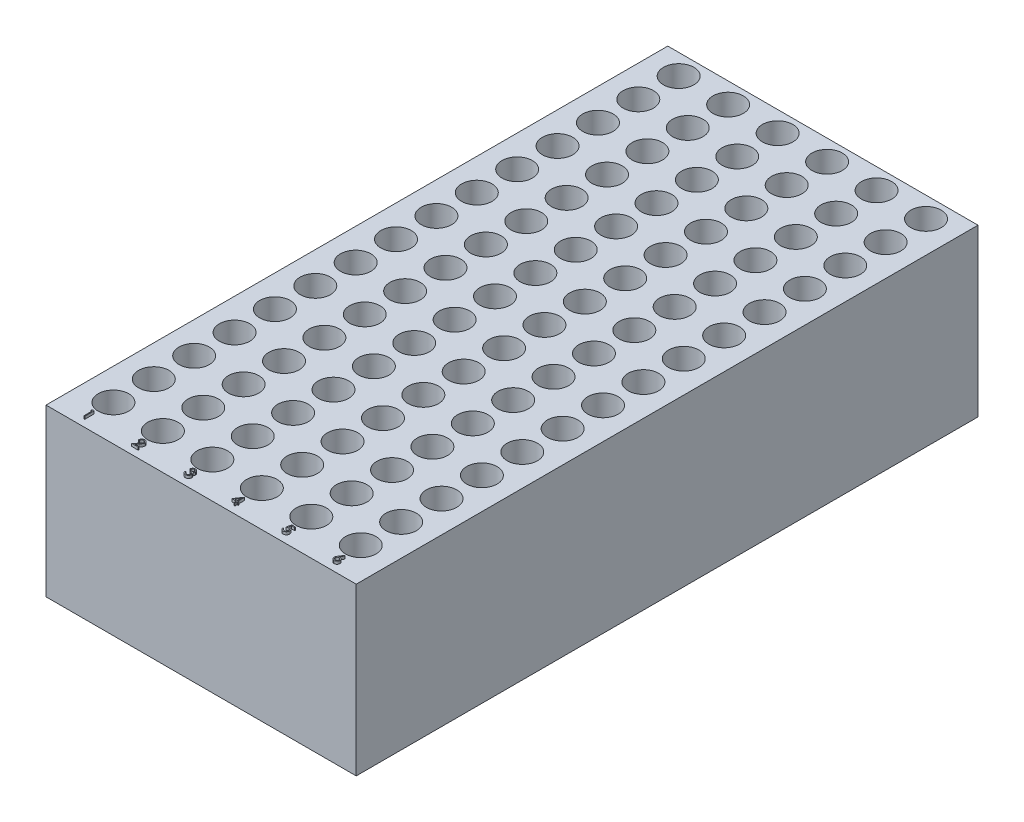
from build123d import *

# Parameters (mm, degrees)
SKETCH1_W           = 115.25
SKETCH1_H           = 231
SKETCH1_R           = 5.65
BOSS_EXTRUDE1_DEPTH = 51.7
SKETCH2_W           = 115.25
SKETCH2_H           = 231
BOSS_EXTRUDE2_DEPTH = 10
SKETCH3_R           = 5.65
SKETCH3_R_2         = 4.225
BOSS_EXTRUDE4_DEPTH = 30
BOSS_EXTRUDE5_DEPTH = 1


with BuildPart() as part:
    # Sketch1 → Boss-Extrude1 (new body)
    with BuildSketch(Plane(origin=(0, 0, 0), x_dir=(1, 0, 0), z_dir=(0, 1, 0))):
        Rectangle(SKETCH1_W, SKETCH1_H)
        with Locations((-45.946843854, 107.87)):
            Circle(SKETCH1_R, mode=Mode.SUBTRACT)
        with Locations((-27.568106312, 107.87)):
            Circle(SKETCH1_R, mode=Mode.SUBTRACT)
        with Locations((-9.189368771, 107.87)):
            Circle(SKETCH1_R, mode=Mode.SUBTRACT)
        with Locations((9.189368771, 107.87)):
            Circle(SKETCH1_R, mode=Mode.SUBTRACT)
        with Locations((27.568106312, 107.87)):
            Circle(SKETCH1_R, mode=Mode.SUBTRACT)
        with Locations((45.946843854, 107.87)):
            Circle(SKETCH1_R, mode=Mode.SUBTRACT)
        with Locations((-45.946843854, 92.87)):
            Circle(SKETCH1_R, mode=Mode.SUBTRACT)
        with Locations((-27.568106312, 92.87)):
            Circle(SKETCH1_R, mode=Mode.SUBTRACT)
        with Locations((-9.189368771, 92.87)):
            Circle(SKETCH1_R, mode=Mode.SUBTRACT)
        with Locations((9.189368771, 92.87)):
            Circle(SKETCH1_R, mode=Mode.SUBTRACT)
        with Locations((27.568106312, 92.87)):
            Circle(SKETCH1_R, mode=Mode.SUBTRACT)
        with Locations((45.946843854, 92.87)):
            Circle(SKETCH1_R, mode=Mode.SUBTRACT)
        with Locations((-45.946843854, 77.87)):
            Circle(SKETCH1_R, mode=Mode.SUBTRACT)
        with Locations((-27.568106312, 77.87)):
            Circle(SKETCH1_R, mode=Mode.SUBTRACT)
        with Locations((-9.189368771, 77.87)):
            Circle(SKETCH1_R, mode=Mode.SUBTRACT)
        with Locations((9.189368771, 77.87)):
            Circle(SKETCH1_R, mode=Mode.SUBTRACT)
        with Locations((27.568106312, 77.87)):
            Circle(SKETCH1_R, mode=Mode.SUBTRACT)
        with Locations((45.946843854, 77.87)):
            Circle(SKETCH1_R, mode=Mode.SUBTRACT)
        with Locations((-45.946843854, 62.87)):
            Circle(SKETCH1_R, mode=Mode.SUBTRACT)
        with Locations((-27.568106312, 62.87)):
            Circle(SKETCH1_R, mode=Mode.SUBTRACT)
        with Locations((-9.189368771, 62.87)):
            Circle(SKETCH1_R, mode=Mode.SUBTRACT)
        with Locations((9.189368771, 62.87)):
            Circle(SKETCH1_R, mode=Mode.SUBTRACT)
        with Locations((27.568106312, 62.87)):
            Circle(SKETCH1_R, mode=Mode.SUBTRACT)
        with Locations((45.946843854, 62.87)):
            Circle(SKETCH1_R, mode=Mode.SUBTRACT)
        with Locations((-45.946843854, 47.87)):
            Circle(SKETCH1_R, mode=Mode.SUBTRACT)
        with Locations((-27.568106312, 47.87)):
            Circle(SKETCH1_R, mode=Mode.SUBTRACT)
        with Locations((-9.189368771, 47.87)):
            Circle(SKETCH1_R, mode=Mode.SUBTRACT)
        with Locations((9.189368771, 47.87)):
            Circle(SKETCH1_R, mode=Mode.SUBTRACT)
        with Locations((27.568106312, 47.87)):
            Circle(SKETCH1_R, mode=Mode.SUBTRACT)
        with Locations((45.946843854, 47.87)):
            Circle(SKETCH1_R, mode=Mode.SUBTRACT)
        with Locations((-45.946843854, 32.87)):
            Circle(SKETCH1_R, mode=Mode.SUBTRACT)
        with Locations((-27.568106312, 32.87)):
            Circle(SKETCH1_R, mode=Mode.SUBTRACT)
        with Locations((-9.189368771, 32.87)):
            Circle(SKETCH1_R, mode=Mode.SUBTRACT)
        with Locations((9.189368771, 32.87)):
            Circle(SKETCH1_R, mode=Mode.SUBTRACT)
        with Locations((27.568106312, 32.87)):
            Circle(SKETCH1_R, mode=Mode.SUBTRACT)
        with Locations((45.946843854, 32.87)):
            Circle(SKETCH1_R, mode=Mode.SUBTRACT)
        with Locations((-45.946843854, 17.87)):
            Circle(SKETCH1_R, mode=Mode.SUBTRACT)
        with Locations((-27.568106312, 17.87)):
            Circle(SKETCH1_R, mode=Mode.SUBTRACT)
        with Locations((-9.189368771, 17.87)):
            Circle(SKETCH1_R, mode=Mode.SUBTRACT)
        with Locations((9.189368771, 17.87)):
            Circle(SKETCH1_R, mode=Mode.SUBTRACT)
        with Locations((27.568106312, 17.87)):
            Circle(SKETCH1_R, mode=Mode.SUBTRACT)
        with Locations((45.946843854, 17.87)):
            Circle(SKETCH1_R, mode=Mode.SUBTRACT)
        with Locations((-45.946843854, 2.87)):
            Circle(SKETCH1_R, mode=Mode.SUBTRACT)
        with Locations((-27.568106312, 2.87)):
            Circle(SKETCH1_R, mode=Mode.SUBTRACT)
        with Locations((-9.189368771, 2.87)):
            Circle(SKETCH1_R, mode=Mode.SUBTRACT)
        with Locations((9.189368771, 2.87)):
            Circle(SKETCH1_R, mode=Mode.SUBTRACT)
        with Locations((27.568106312, 2.87)):
            Circle(SKETCH1_R, mode=Mode.SUBTRACT)
        with Locations((45.946843854, 2.87)):
            Circle(SKETCH1_R, mode=Mode.SUBTRACT)
        with Locations((-45.946843854, -12.13)):
            Circle(SKETCH1_R, mode=Mode.SUBTRACT)
        with Locations((-27.568106312, -12.13)):
            Circle(SKETCH1_R, mode=Mode.SUBTRACT)
        with Locations((-9.189368771, -12.13)):
            Circle(SKETCH1_R, mode=Mode.SUBTRACT)
        with Locations((9.189368771, -12.13)):
            Circle(SKETCH1_R, mode=Mode.SUBTRACT)
        with Locations((27.568106312, -12.13)):
            Circle(SKETCH1_R, mode=Mode.SUBTRACT)
        with Locations((45.946843854, -12.13)):
            Circle(SKETCH1_R, mode=Mode.SUBTRACT)
        with Locations((-45.946843854, -27.13)):
            Circle(SKETCH1_R, mode=Mode.SUBTRACT)
        with Locations((-27.568106312, -27.13)):
            Circle(SKETCH1_R, mode=Mode.SUBTRACT)
        with Locations((-9.189368771, -27.13)):
            Circle(SKETCH1_R, mode=Mode.SUBTRACT)
        with Locations((9.189368771, -27.13)):
            Circle(SKETCH1_R, mode=Mode.SUBTRACT)
        with Locations((27.568106312, -27.13)):
            Circle(SKETCH1_R, mode=Mode.SUBTRACT)
        with Locations((45.946843854, -27.13)):
            Circle(SKETCH1_R, mode=Mode.SUBTRACT)
        with Locations((-45.946843854, -42.13)):
            Circle(SKETCH1_R, mode=Mode.SUBTRACT)
        with Locations((-27.568106312, -42.13)):
            Circle(SKETCH1_R, mode=Mode.SUBTRACT)
        with Locations((-9.189368771, -42.13)):
            Circle(SKETCH1_R, mode=Mode.SUBTRACT)
        with Locations((9.189368771, -42.13)):
            Circle(SKETCH1_R, mode=Mode.SUBTRACT)
        with Locations((27.568106312, -42.13)):
            Circle(SKETCH1_R, mode=Mode.SUBTRACT)
        with Locations((45.946843854, -42.13)):
            Circle(SKETCH1_R, mode=Mode.SUBTRACT)
        with Locations((-45.946843854, -57.13)):
            Circle(SKETCH1_R, mode=Mode.SUBTRACT)
        with Locations((-27.568106312, -57.13)):
            Circle(SKETCH1_R, mode=Mode.SUBTRACT)
        with Locations((-9.189368771, -57.13)):
            Circle(SKETCH1_R, mode=Mode.SUBTRACT)
        with Locations((9.189368771, -57.13)):
            Circle(SKETCH1_R, mode=Mode.SUBTRACT)
        with Locations((27.568106312, -57.13)):
            Circle(SKETCH1_R, mode=Mode.SUBTRACT)
        with Locations((45.946843854, -57.13)):
            Circle(SKETCH1_R, mode=Mode.SUBTRACT)
        with Locations((-45.946843854, -72.13)):
            Circle(SKETCH1_R, mode=Mode.SUBTRACT)
        with Locations((-27.568106312, -72.13)):
            Circle(SKETCH1_R, mode=Mode.SUBTRACT)
        with Locations((-9.189368771, -72.13)):
            Circle(SKETCH1_R, mode=Mode.SUBTRACT)
        with Locations((9.189368771, -72.13)):
            Circle(SKETCH1_R, mode=Mode.SUBTRACT)
        with Locations((27.568106312, -72.13)):
            Circle(SKETCH1_R, mode=Mode.SUBTRACT)
        with Locations((45.946843854, -72.13)):
            Circle(SKETCH1_R, mode=Mode.SUBTRACT)
        with Locations((-45.946843854, -87.13)):
            Circle(SKETCH1_R, mode=Mode.SUBTRACT)
        with Locations((-27.568106312, -87.13)):
            Circle(SKETCH1_R, mode=Mode.SUBTRACT)
        with Locations((-9.189368771, -87.13)):
            Circle(SKETCH1_R, mode=Mode.SUBTRACT)
        with Locations((9.189368771, -87.13)):
            Circle(SKETCH1_R, mode=Mode.SUBTRACT)
        with Locations((27.568106312, -87.13)):
            Circle(SKETCH1_R, mode=Mode.SUBTRACT)
        with Locations((45.946843854, -87.13)):
            Circle(SKETCH1_R, mode=Mode.SUBTRACT)
        with Locations((-45.946843854, -102.13)):
            Circle(SKETCH1_R, mode=Mode.SUBTRACT)
        with Locations((-27.568106312, -102.13)):
            Circle(SKETCH1_R, mode=Mode.SUBTRACT)
        with Locations((-9.189368771, -102.13)):
            Circle(SKETCH1_R, mode=Mode.SUBTRACT)
        with Locations((9.189368771, -102.13)):
            Circle(SKETCH1_R, mode=Mode.SUBTRACT)
        with Locations((27.568106312, -102.13)):
            Circle(SKETCH1_R, mode=Mode.SUBTRACT)
        with Locations((45.946843854, -102.13)):
            Circle(SKETCH1_R, mode=Mode.SUBTRACT)
    extrude(amount=BOSS_EXTRUDE1_DEPTH)

    # Sketch2 → Boss-Extrude2 (add)
    with BuildSketch(Plane.XZ):
        Rectangle(SKETCH2_W, SKETCH2_H)
    extrude(amount=BOSS_EXTRUDE2_DEPTH)

    # Sketch3 → Boss-Extrude4 (add)
    # profile 1 of 90: a face of its own
    with BuildSketch(Plane(origin=(0, 0, 0), x_dir=(1, 0, 0), z_dir=(0, 1, 0))):
        with Locations((-45.946843854, -102.13)):
            Circle(SKETCH3_R)
        with Locations((-45.946843854, -102.13)):
            Circle(SKETCH3_R_2, mode=Mode.SUBTRACT)
    # profile 2 of 90: a face of its own
    with BuildSketch(Plane(origin=(0, 0, 0), x_dir=(1, 0, 0), z_dir=(0, 1, 0))):
        with Locations((-27.566843854, -102.13)):
            Circle(SKETCH3_R)
        with Locations((-27.566843854, -102.13)):
            Circle(SKETCH3_R_2, mode=Mode.SUBTRACT)
    # profile 3 of 90: a face of its own
    with BuildSketch(Plane(origin=(0, 0, 0), x_dir=(1, 0, 0), z_dir=(0, 1, 0))):
        with Locations((-9.186843854, -102.13)):
            Circle(SKETCH3_R)
        with Locations((-9.186843854, -102.13)):
            Circle(SKETCH3_R_2, mode=Mode.SUBTRACT)
    # profile 4 of 90: a face of its own
    with BuildSketch(Plane(origin=(0, 0, 0), x_dir=(1, 0, 0), z_dir=(0, 1, 0))):
        with Locations((9.193156146, -102.13)):
            Circle(SKETCH3_R)
        with Locations((9.193156146, -102.13)):
            Circle(SKETCH3_R_2, mode=Mode.SUBTRACT)
    # profile 5 of 90: a face of its own
    with BuildSketch(Plane(origin=(0, 0, 0), x_dir=(1, 0, 0), z_dir=(0, 1, 0))):
        with Locations((27.573156146, -102.13)):
            Circle(SKETCH3_R)
        with Locations((27.573156146, -102.13)):
            Circle(SKETCH3_R_2, mode=Mode.SUBTRACT)
    # profile 6 of 90: a face of its own
    with BuildSketch(Plane(origin=(0, 0, 0), x_dir=(1, 0, 0), z_dir=(0, 1, 0))):
        with Locations((45.953156146, -102.13)):
            Circle(SKETCH3_R)
        with Locations((45.953156146, -102.13)):
            Circle(SKETCH3_R_2, mode=Mode.SUBTRACT)
    # profile 7 of 90: a face of its own
    with BuildSketch(Plane(origin=(0, 0, 0), x_dir=(1, 0, 0), z_dir=(0, 1, 0))):
        with Locations((-27.566843854, -87.13)):
            Circle(SKETCH3_R)
        with Locations((-27.566843854, -87.13)):
            Circle(SKETCH3_R_2, mode=Mode.SUBTRACT)
    # profile 8 of 90: a face of its own
    with BuildSketch(Plane(origin=(0, 0, 0), x_dir=(1, 0, 0), z_dir=(0, 1, 0))):
        with Locations((-9.186843854, -87.13)):
            Circle(SKETCH3_R)
        with Locations((-9.186843854, -87.13)):
            Circle(SKETCH3_R_2, mode=Mode.SUBTRACT)
    # profile 9 of 90: a face of its own
    with BuildSketch(Plane(origin=(0, 0, 0), x_dir=(1, 0, 0), z_dir=(0, 1, 0))):
        with Locations((9.193156146, -87.13)):
            Circle(SKETCH3_R)
        with Locations((9.193156146, -87.13)):
            Circle(SKETCH3_R_2, mode=Mode.SUBTRACT)
    # profile 10 of 90: a face of its own
    with BuildSketch(Plane(origin=(0, 0, 0), x_dir=(1, 0, 0), z_dir=(0, 1, 0))):
        with Locations((27.573156146, -87.13)):
            Circle(SKETCH3_R)
        with Locations((27.573156146, -87.13)):
            Circle(SKETCH3_R_2, mode=Mode.SUBTRACT)
    # profile 11 of 90: a face of its own
    with BuildSketch(Plane(origin=(0, 0, 0), x_dir=(1, 0, 0), z_dir=(0, 1, 0))):
        with Locations((45.953156146, -87.13)):
            Circle(SKETCH3_R)
        with Locations((45.953156146, -87.13)):
            Circle(SKETCH3_R_2, mode=Mode.SUBTRACT)
    # profile 12 of 90: a face of its own
    with BuildSketch(Plane(origin=(0, 0, 0), x_dir=(1, 0, 0), z_dir=(0, 1, 0))):
        with Locations((-27.566843854, -72.13)):
            Circle(SKETCH3_R)
        with Locations((-27.566843854, -72.13)):
            Circle(SKETCH3_R_2, mode=Mode.SUBTRACT)
    # profile 13 of 90: a face of its own
    with BuildSketch(Plane(origin=(0, 0, 0), x_dir=(1, 0, 0), z_dir=(0, 1, 0))):
        with Locations((-9.186843854, -72.13)):
            Circle(SKETCH3_R)
        with Locations((-9.186843854, -72.13)):
            Circle(SKETCH3_R_2, mode=Mode.SUBTRACT)
    # profile 14 of 90: a face of its own
    with BuildSketch(Plane(origin=(0, 0, 0), x_dir=(1, 0, 0), z_dir=(0, 1, 0))):
        with Locations((9.193156146, -72.13)):
            Circle(SKETCH3_R)
        with Locations((9.193156146, -72.13)):
            Circle(SKETCH3_R_2, mode=Mode.SUBTRACT)
    # profile 15 of 90: a face of its own
    with BuildSketch(Plane(origin=(0, 0, 0), x_dir=(1, 0, 0), z_dir=(0, 1, 0))):
        with Locations((27.573156146, -72.13)):
            Circle(SKETCH3_R)
        with Locations((27.573156146, -72.13)):
            Circle(SKETCH3_R_2, mode=Mode.SUBTRACT)
    # profile 16 of 90: a face of its own
    with BuildSketch(Plane(origin=(0, 0, 0), x_dir=(1, 0, 0), z_dir=(0, 1, 0))):
        with Locations((45.953156146, -72.13)):
            Circle(SKETCH3_R)
        with Locations((45.953156146, -72.13)):
            Circle(SKETCH3_R_2, mode=Mode.SUBTRACT)
    # profile 17 of 90: a face of its own
    with BuildSketch(Plane(origin=(0, 0, 0), x_dir=(1, 0, 0), z_dir=(0, 1, 0))):
        with Locations((-27.566843854, -57.13)):
            Circle(SKETCH3_R)
        with Locations((-27.566843854, -57.13)):
            Circle(SKETCH3_R_2, mode=Mode.SUBTRACT)
    # profile 18 of 90: a face of its own
    with BuildSketch(Plane(origin=(0, 0, 0), x_dir=(1, 0, 0), z_dir=(0, 1, 0))):
        with Locations((-9.186843854, -57.13)):
            Circle(SKETCH3_R)
        with Locations((-9.186843854, -57.13)):
            Circle(SKETCH3_R_2, mode=Mode.SUBTRACT)
    # profile 19 of 90: a face of its own
    with BuildSketch(Plane(origin=(0, 0, 0), x_dir=(1, 0, 0), z_dir=(0, 1, 0))):
        with Locations((9.193156146, -57.13)):
            Circle(SKETCH3_R)
        with Locations((9.193156146, -57.13)):
            Circle(SKETCH3_R_2, mode=Mode.SUBTRACT)
    # profile 20 of 90: a face of its own
    with BuildSketch(Plane(origin=(0, 0, 0), x_dir=(1, 0, 0), z_dir=(0, 1, 0))):
        with Locations((27.573156146, -57.13)):
            Circle(SKETCH3_R)
        with Locations((27.573156146, -57.13)):
            Circle(SKETCH3_R_2, mode=Mode.SUBTRACT)
    # profile 21 of 90: a face of its own
    with BuildSketch(Plane(origin=(0, 0, 0), x_dir=(1, 0, 0), z_dir=(0, 1, 0))):
        with Locations((45.953156146, -57.13)):
            Circle(SKETCH3_R)
        with Locations((45.953156146, -57.13)):
            Circle(SKETCH3_R_2, mode=Mode.SUBTRACT)
    # profile 22 of 90: a face of its own
    with BuildSketch(Plane(origin=(0, 0, 0), x_dir=(1, 0, 0), z_dir=(0, 1, 0))):
        with Locations((-27.566843854, -42.13)):
            Circle(SKETCH3_R)
        with Locations((-27.566843854, -42.13)):
            Circle(SKETCH3_R_2, mode=Mode.SUBTRACT)
    # profile 23 of 90: a face of its own
    with BuildSketch(Plane(origin=(0, 0, 0), x_dir=(1, 0, 0), z_dir=(0, 1, 0))):
        with Locations((-9.186843854, -42.13)):
            Circle(SKETCH3_R)
        with Locations((-9.186843854, -42.13)):
            Circle(SKETCH3_R_2, mode=Mode.SUBTRACT)
    # profile 24 of 90: a face of its own
    with BuildSketch(Plane(origin=(0, 0, 0), x_dir=(1, 0, 0), z_dir=(0, 1, 0))):
        with Locations((9.193156146, -42.13)):
            Circle(SKETCH3_R)
        with Locations((9.193156146, -42.13)):
            Circle(SKETCH3_R_2, mode=Mode.SUBTRACT)
    # profile 25 of 90: a face of its own
    with BuildSketch(Plane(origin=(0, 0, 0), x_dir=(1, 0, 0), z_dir=(0, 1, 0))):
        with Locations((27.573156146, -42.13)):
            Circle(SKETCH3_R)
        with Locations((27.573156146, -42.13)):
            Circle(SKETCH3_R_2, mode=Mode.SUBTRACT)
    # profile 26 of 90: a face of its own
    with BuildSketch(Plane(origin=(0, 0, 0), x_dir=(1, 0, 0), z_dir=(0, 1, 0))):
        with Locations((45.953156146, -42.13)):
            Circle(SKETCH3_R)
        with Locations((45.953156146, -42.13)):
            Circle(SKETCH3_R_2, mode=Mode.SUBTRACT)
    # profile 27 of 90: a face of its own
    with BuildSketch(Plane(origin=(0, 0, 0), x_dir=(1, 0, 0), z_dir=(0, 1, 0))):
        with Locations((-27.566843854, -27.13)):
            Circle(SKETCH3_R)
        with Locations((-27.566843854, -27.13)):
            Circle(SKETCH3_R_2, mode=Mode.SUBTRACT)
    # profile 28 of 90: a face of its own
    with BuildSketch(Plane(origin=(0, 0, 0), x_dir=(1, 0, 0), z_dir=(0, 1, 0))):
        with Locations((-9.186843854, -27.13)):
            Circle(SKETCH3_R)
        with Locations((-9.186843854, -27.13)):
            Circle(SKETCH3_R_2, mode=Mode.SUBTRACT)
    # profile 29 of 90: a face of its own
    with BuildSketch(Plane(origin=(0, 0, 0), x_dir=(1, 0, 0), z_dir=(0, 1, 0))):
        with Locations((9.193156146, -27.13)):
            Circle(SKETCH3_R)
        with Locations((9.193156146, -27.13)):
            Circle(SKETCH3_R_2, mode=Mode.SUBTRACT)
    # profile 30 of 90: a face of its own
    with BuildSketch(Plane(origin=(0, 0, 0), x_dir=(1, 0, 0), z_dir=(0, 1, 0))):
        with Locations((27.573156146, -27.13)):
            Circle(SKETCH3_R)
        with Locations((27.573156146, -27.13)):
            Circle(SKETCH3_R_2, mode=Mode.SUBTRACT)
    # profile 31 of 90: a face of its own
    with BuildSketch(Plane(origin=(0, 0, 0), x_dir=(1, 0, 0), z_dir=(0, 1, 0))):
        with Locations((45.953156146, -27.13)):
            Circle(SKETCH3_R)
        with Locations((45.953156146, -27.13)):
            Circle(SKETCH3_R_2, mode=Mode.SUBTRACT)
    # profile 32 of 90: a face of its own
    with BuildSketch(Plane(origin=(0, 0, 0), x_dir=(1, 0, 0), z_dir=(0, 1, 0))):
        with Locations((-27.566843854, -12.13)):
            Circle(SKETCH3_R)
        with Locations((-27.566843854, -12.13)):
            Circle(SKETCH3_R_2, mode=Mode.SUBTRACT)
    # profile 33 of 90: a face of its own
    with BuildSketch(Plane(origin=(0, 0, 0), x_dir=(1, 0, 0), z_dir=(0, 1, 0))):
        with Locations((-9.186843854, -12.13)):
            Circle(SKETCH3_R)
        with Locations((-9.186843854, -12.13)):
            Circle(SKETCH3_R_2, mode=Mode.SUBTRACT)
    # profile 34 of 90: a face of its own
    with BuildSketch(Plane(origin=(0, 0, 0), x_dir=(1, 0, 0), z_dir=(0, 1, 0))):
        with Locations((9.193156146, -12.13)):
            Circle(SKETCH3_R)
        with Locations((9.193156146, -12.13)):
            Circle(SKETCH3_R_2, mode=Mode.SUBTRACT)
    # profile 35 of 90: a face of its own
    with BuildSketch(Plane(origin=(0, 0, 0), x_dir=(1, 0, 0), z_dir=(0, 1, 0))):
        with Locations((27.573156146, -12.13)):
            Circle(SKETCH3_R)
        with Locations((27.573156146, -12.13)):
            Circle(SKETCH3_R_2, mode=Mode.SUBTRACT)
    # profile 36 of 90: a face of its own
    with BuildSketch(Plane(origin=(0, 0, 0), x_dir=(1, 0, 0), z_dir=(0, 1, 0))):
        with Locations((45.953156146, -12.13)):
            Circle(SKETCH3_R)
        with Locations((45.953156146, -12.13)):
            Circle(SKETCH3_R_2, mode=Mode.SUBTRACT)
    # profile 37 of 90: a face of its own
    with BuildSketch(Plane(origin=(0, 0, 0), x_dir=(1, 0, 0), z_dir=(0, 1, 0))):
        with Locations((-27.566843854, 2.87)):
            Circle(SKETCH3_R)
        with Locations((-27.566843854, 2.87)):
            Circle(SKETCH3_R_2, mode=Mode.SUBTRACT)
    # profile 38 of 90: a face of its own
    with BuildSketch(Plane(origin=(0, 0, 0), x_dir=(1, 0, 0), z_dir=(0, 1, 0))):
        with Locations((-9.186843854, 2.87)):
            Circle(SKETCH3_R)
        with Locations((-9.186843854, 2.87)):
            Circle(SKETCH3_R_2, mode=Mode.SUBTRACT)
    # profile 39 of 90: a face of its own
    with BuildSketch(Plane(origin=(0, 0, 0), x_dir=(1, 0, 0), z_dir=(0, 1, 0))):
        with Locations((9.193156146, 2.87)):
            Circle(SKETCH3_R)
        with Locations((9.193156146, 2.87)):
            Circle(SKETCH3_R_2, mode=Mode.SUBTRACT)
    # profile 40 of 90: a face of its own
    with BuildSketch(Plane(origin=(0, 0, 0), x_dir=(1, 0, 0), z_dir=(0, 1, 0))):
        with Locations((27.573156146, 2.87)):
            Circle(SKETCH3_R)
        with Locations((27.573156146, 2.87)):
            Circle(SKETCH3_R_2, mode=Mode.SUBTRACT)
    # profile 41 of 90: a face of its own
    with BuildSketch(Plane(origin=(0, 0, 0), x_dir=(1, 0, 0), z_dir=(0, 1, 0))):
        with Locations((45.953156146, 2.87)):
            Circle(SKETCH3_R)
        with Locations((45.953156146, 2.87)):
            Circle(SKETCH3_R_2, mode=Mode.SUBTRACT)
    # profile 42 of 90: a face of its own
    with BuildSketch(Plane(origin=(0, 0, 0), x_dir=(1, 0, 0), z_dir=(0, 1, 0))):
        with Locations((-27.566843854, 17.87)):
            Circle(SKETCH3_R)
        with Locations((-27.566843854, 17.87)):
            Circle(SKETCH3_R_2, mode=Mode.SUBTRACT)
    # profile 43 of 90: a face of its own
    with BuildSketch(Plane(origin=(0, 0, 0), x_dir=(1, 0, 0), z_dir=(0, 1, 0))):
        with Locations((-9.186843854, 17.87)):
            Circle(SKETCH3_R)
        with Locations((-9.186843854, 17.87)):
            Circle(SKETCH3_R_2, mode=Mode.SUBTRACT)
    # profile 44 of 90: a face of its own
    with BuildSketch(Plane(origin=(0, 0, 0), x_dir=(1, 0, 0), z_dir=(0, 1, 0))):
        with Locations((9.193156146, 17.87)):
            Circle(SKETCH3_R)
        with Locations((9.193156146, 17.87)):
            Circle(SKETCH3_R_2, mode=Mode.SUBTRACT)
    # profile 45 of 90: a face of its own
    with BuildSketch(Plane(origin=(0, 0, 0), x_dir=(1, 0, 0), z_dir=(0, 1, 0))):
        with Locations((27.573156146, 17.87)):
            Circle(SKETCH3_R)
        with Locations((27.573156146, 17.87)):
            Circle(SKETCH3_R_2, mode=Mode.SUBTRACT)
    # profile 46 of 90: a face of its own
    with BuildSketch(Plane(origin=(0, 0, 0), x_dir=(1, 0, 0), z_dir=(0, 1, 0))):
        with Locations((45.953156146, 17.87)):
            Circle(SKETCH3_R)
        with Locations((45.953156146, 17.87)):
            Circle(SKETCH3_R_2, mode=Mode.SUBTRACT)
    # profile 47 of 90: a face of its own
    with BuildSketch(Plane(origin=(0, 0, 0), x_dir=(1, 0, 0), z_dir=(0, 1, 0))):
        with Locations((-27.566843854, 32.87)):
            Circle(SKETCH3_R)
        with Locations((-27.566843854, 32.87)):
            Circle(SKETCH3_R_2, mode=Mode.SUBTRACT)
    # profile 48 of 90: a face of its own
    with BuildSketch(Plane(origin=(0, 0, 0), x_dir=(1, 0, 0), z_dir=(0, 1, 0))):
        with Locations((-9.186843854, 32.87)):
            Circle(SKETCH3_R)
        with Locations((-9.186843854, 32.87)):
            Circle(SKETCH3_R_2, mode=Mode.SUBTRACT)
    # profile 49 of 90: a face of its own
    with BuildSketch(Plane(origin=(0, 0, 0), x_dir=(1, 0, 0), z_dir=(0, 1, 0))):
        with Locations((9.193156146, 32.87)):
            Circle(SKETCH3_R)
        with Locations((9.193156146, 32.87)):
            Circle(SKETCH3_R_2, mode=Mode.SUBTRACT)
    # profile 50 of 90: a face of its own
    with BuildSketch(Plane(origin=(0, 0, 0), x_dir=(1, 0, 0), z_dir=(0, 1, 0))):
        with Locations((27.573156146, 32.87)):
            Circle(SKETCH3_R)
        with Locations((27.573156146, 32.87)):
            Circle(SKETCH3_R_2, mode=Mode.SUBTRACT)
    # profile 51 of 90: a face of its own
    with BuildSketch(Plane(origin=(0, 0, 0), x_dir=(1, 0, 0), z_dir=(0, 1, 0))):
        with Locations((45.953156146, 32.87)):
            Circle(SKETCH3_R)
        with Locations((45.953156146, 32.87)):
            Circle(SKETCH3_R_2, mode=Mode.SUBTRACT)
    # profile 52 of 90: a face of its own
    with BuildSketch(Plane(origin=(0, 0, 0), x_dir=(1, 0, 0), z_dir=(0, 1, 0))):
        with Locations((-27.566843854, 47.87)):
            Circle(SKETCH3_R)
        with Locations((-27.566843854, 47.87)):
            Circle(SKETCH3_R_2, mode=Mode.SUBTRACT)
    # profile 53 of 90: a face of its own
    with BuildSketch(Plane(origin=(0, 0, 0), x_dir=(1, 0, 0), z_dir=(0, 1, 0))):
        with Locations((-9.186843854, 47.87)):
            Circle(SKETCH3_R)
        with Locations((-9.186843854, 47.87)):
            Circle(SKETCH3_R_2, mode=Mode.SUBTRACT)
    # profile 54 of 90: a face of its own
    with BuildSketch(Plane(origin=(0, 0, 0), x_dir=(1, 0, 0), z_dir=(0, 1, 0))):
        with Locations((9.193156146, 47.87)):
            Circle(SKETCH3_R)
        with Locations((9.193156146, 47.87)):
            Circle(SKETCH3_R_2, mode=Mode.SUBTRACT)
    # profile 55 of 90: a face of its own
    with BuildSketch(Plane(origin=(0, 0, 0), x_dir=(1, 0, 0), z_dir=(0, 1, 0))):
        with Locations((27.573156146, 47.87)):
            Circle(SKETCH3_R)
        with Locations((27.573156146, 47.87)):
            Circle(SKETCH3_R_2, mode=Mode.SUBTRACT)
    # profile 56 of 90: a face of its own
    with BuildSketch(Plane(origin=(0, 0, 0), x_dir=(1, 0, 0), z_dir=(0, 1, 0))):
        with Locations((45.953156146, 47.87)):
            Circle(SKETCH3_R)
        with Locations((45.953156146, 47.87)):
            Circle(SKETCH3_R_2, mode=Mode.SUBTRACT)
    # profile 57 of 90: a face of its own
    with BuildSketch(Plane(origin=(0, 0, 0), x_dir=(1, 0, 0), z_dir=(0, 1, 0))):
        with Locations((-27.566843854, 62.87)):
            Circle(SKETCH3_R)
        with Locations((-27.566843854, 62.87)):
            Circle(SKETCH3_R_2, mode=Mode.SUBTRACT)
    # profile 58 of 90: a face of its own
    with BuildSketch(Plane(origin=(0, 0, 0), x_dir=(1, 0, 0), z_dir=(0, 1, 0))):
        with Locations((-9.186843854, 62.87)):
            Circle(SKETCH3_R)
        with Locations((-9.186843854, 62.87)):
            Circle(SKETCH3_R_2, mode=Mode.SUBTRACT)
    # profile 59 of 90: a face of its own
    with BuildSketch(Plane(origin=(0, 0, 0), x_dir=(1, 0, 0), z_dir=(0, 1, 0))):
        with Locations((9.193156146, 62.87)):
            Circle(SKETCH3_R)
        with Locations((9.193156146, 62.87)):
            Circle(SKETCH3_R_2, mode=Mode.SUBTRACT)
    # profile 60 of 90: a face of its own
    with BuildSketch(Plane(origin=(0, 0, 0), x_dir=(1, 0, 0), z_dir=(0, 1, 0))):
        with Locations((27.573156146, 62.87)):
            Circle(SKETCH3_R)
        with Locations((27.573156146, 62.87)):
            Circle(SKETCH3_R_2, mode=Mode.SUBTRACT)
    # profile 61 of 90: a face of its own
    with BuildSketch(Plane(origin=(0, 0, 0), x_dir=(1, 0, 0), z_dir=(0, 1, 0))):
        with Locations((45.953156146, 62.87)):
            Circle(SKETCH3_R)
        with Locations((45.953156146, 62.87)):
            Circle(SKETCH3_R_2, mode=Mode.SUBTRACT)
    # profile 62 of 90: a face of its own
    with BuildSketch(Plane(origin=(0, 0, 0), x_dir=(1, 0, 0), z_dir=(0, 1, 0))):
        with Locations((-27.566843854, 77.87)):
            Circle(SKETCH3_R)
        with Locations((-27.566843854, 77.87)):
            Circle(SKETCH3_R_2, mode=Mode.SUBTRACT)
    # profile 63 of 90: a face of its own
    with BuildSketch(Plane(origin=(0, 0, 0), x_dir=(1, 0, 0), z_dir=(0, 1, 0))):
        with Locations((-9.186843854, 77.87)):
            Circle(SKETCH3_R)
        with Locations((-9.186843854, 77.87)):
            Circle(SKETCH3_R_2, mode=Mode.SUBTRACT)
    # profile 64 of 90: a face of its own
    with BuildSketch(Plane(origin=(0, 0, 0), x_dir=(1, 0, 0), z_dir=(0, 1, 0))):
        with Locations((9.193156146, 77.87)):
            Circle(SKETCH3_R)
        with Locations((9.193156146, 77.87)):
            Circle(SKETCH3_R_2, mode=Mode.SUBTRACT)
    # profile 65 of 90: a face of its own
    with BuildSketch(Plane(origin=(0, 0, 0), x_dir=(1, 0, 0), z_dir=(0, 1, 0))):
        with Locations((27.573156146, 77.87)):
            Circle(SKETCH3_R)
        with Locations((27.573156146, 77.87)):
            Circle(SKETCH3_R_2, mode=Mode.SUBTRACT)
    # profile 66 of 90: a face of its own
    with BuildSketch(Plane(origin=(0, 0, 0), x_dir=(1, 0, 0), z_dir=(0, 1, 0))):
        with Locations((45.953156146, 77.87)):
            Circle(SKETCH3_R)
        with Locations((45.953156146, 77.87)):
            Circle(SKETCH3_R_2, mode=Mode.SUBTRACT)
    # profile 67 of 90: a face of its own
    with BuildSketch(Plane(origin=(0, 0, 0), x_dir=(1, 0, 0), z_dir=(0, 1, 0))):
        with Locations((-27.566843854, 92.87)):
            Circle(SKETCH3_R)
        with Locations((-27.566843854, 92.87)):
            Circle(SKETCH3_R_2, mode=Mode.SUBTRACT)
    # profile 68 of 90: a face of its own
    with BuildSketch(Plane(origin=(0, 0, 0), x_dir=(1, 0, 0), z_dir=(0, 1, 0))):
        with Locations((-9.186843854, 92.87)):
            Circle(SKETCH3_R)
        with Locations((-9.186843854, 92.87)):
            Circle(SKETCH3_R_2, mode=Mode.SUBTRACT)
    # profile 69 of 90: a face of its own
    with BuildSketch(Plane(origin=(0, 0, 0), x_dir=(1, 0, 0), z_dir=(0, 1, 0))):
        with Locations((9.193156146, 92.87)):
            Circle(SKETCH3_R)
        with Locations((9.193156146, 92.87)):
            Circle(SKETCH3_R_2, mode=Mode.SUBTRACT)
    # profile 70 of 90: a face of its own
    with BuildSketch(Plane(origin=(0, 0, 0), x_dir=(1, 0, 0), z_dir=(0, 1, 0))):
        with Locations((27.573156146, 92.87)):
            Circle(SKETCH3_R)
        with Locations((27.573156146, 92.87)):
            Circle(SKETCH3_R_2, mode=Mode.SUBTRACT)
    # profile 71 of 90: a face of its own
    with BuildSketch(Plane(origin=(0, 0, 0), x_dir=(1, 0, 0), z_dir=(0, 1, 0))):
        with Locations((45.953156146, 92.87)):
            Circle(SKETCH3_R)
        with Locations((45.953156146, 92.87)):
            Circle(SKETCH3_R_2, mode=Mode.SUBTRACT)
    # profile 72 of 90: a face of its own
    with BuildSketch(Plane(origin=(0, 0, 0), x_dir=(1, 0, 0), z_dir=(0, 1, 0))):
        with Locations((-27.566843854, 107.87)):
            Circle(SKETCH3_R)
        with Locations((-27.566843854, 107.87)):
            Circle(SKETCH3_R_2, mode=Mode.SUBTRACT)
    # profile 73 of 90: a face of its own
    with BuildSketch(Plane(origin=(0, 0, 0), x_dir=(1, 0, 0), z_dir=(0, 1, 0))):
        with Locations((-9.186843854, 107.87)):
            Circle(SKETCH3_R)
        with Locations((-9.186843854, 107.87)):
            Circle(SKETCH3_R_2, mode=Mode.SUBTRACT)
    # profile 74 of 90: a face of its own
    with BuildSketch(Plane(origin=(0, 0, 0), x_dir=(1, 0, 0), z_dir=(0, 1, 0))):
        with Locations((9.193156146, 107.87)):
            Circle(SKETCH3_R)
        with Locations((9.193156146, 107.87)):
            Circle(SKETCH3_R_2, mode=Mode.SUBTRACT)
    # profile 75 of 90: a face of its own
    with BuildSketch(Plane(origin=(0, 0, 0), x_dir=(1, 0, 0), z_dir=(0, 1, 0))):
        with Locations((27.573156146, 107.87)):
            Circle(SKETCH3_R)
        with Locations((27.573156146, 107.87)):
            Circle(SKETCH3_R_2, mode=Mode.SUBTRACT)
    # profile 76 of 90: a face of its own
    with BuildSketch(Plane(origin=(0, 0, 0), x_dir=(1, 0, 0), z_dir=(0, 1, 0))):
        with Locations((45.953156146, 107.87)):
            Circle(SKETCH3_R)
        with Locations((45.953156146, 107.87)):
            Circle(SKETCH3_R_2, mode=Mode.SUBTRACT)
    # profile 77 of 90: a face of its own
    with BuildSketch(Plane(origin=(0, 0, 0), x_dir=(1, 0, 0), z_dir=(0, 1, 0))):
        with Locations((-45.946843854, -87.13)):
            Circle(SKETCH3_R)
        with Locations((-45.946843854, -87.13)):
            Circle(SKETCH3_R_2, mode=Mode.SUBTRACT)
    # profile 78 of 90: a face of its own
    with BuildSketch(Plane(origin=(0, 0, 0), x_dir=(1, 0, 0), z_dir=(0, 1, 0))):
        with Locations((-45.946843854, -72.13)):
            Circle(SKETCH3_R)
        with Locations((-45.946843854, -72.13)):
            Circle(SKETCH3_R_2, mode=Mode.SUBTRACT)
    # profile 79 of 90: a face of its own
    with BuildSketch(Plane(origin=(0, 0, 0), x_dir=(1, 0, 0), z_dir=(0, 1, 0))):
        with Locations((-45.946843854, -57.13)):
            Circle(SKETCH3_R)
        with Locations((-45.946843854, -57.13)):
            Circle(SKETCH3_R_2, mode=Mode.SUBTRACT)
    # profile 80 of 90: a face of its own
    with BuildSketch(Plane(origin=(0, 0, 0), x_dir=(1, 0, 0), z_dir=(0, 1, 0))):
        with Locations((-45.946843854, -42.13)):
            Circle(SKETCH3_R)
        with Locations((-45.946843854, -42.13)):
            Circle(SKETCH3_R_2, mode=Mode.SUBTRACT)
    # profile 81 of 90: a face of its own
    with BuildSketch(Plane(origin=(0, 0, 0), x_dir=(1, 0, 0), z_dir=(0, 1, 0))):
        with Locations((-45.946843854, -27.13)):
            Circle(SKETCH3_R)
        with Locations((-45.946843854, -27.13)):
            Circle(SKETCH3_R_2, mode=Mode.SUBTRACT)
    # profile 82 of 90: a face of its own
    with BuildSketch(Plane(origin=(0, 0, 0), x_dir=(1, 0, 0), z_dir=(0, 1, 0))):
        with Locations((-45.946843854, -12.13)):
            Circle(SKETCH3_R)
        with Locations((-45.946843854, -12.13)):
            Circle(SKETCH3_R_2, mode=Mode.SUBTRACT)
    # profile 83 of 90: a face of its own
    with BuildSketch(Plane(origin=(0, 0, 0), x_dir=(1, 0, 0), z_dir=(0, 1, 0))):
        with Locations((-45.946843854, 2.87)):
            Circle(SKETCH3_R)
        with Locations((-45.946843854, 2.87)):
            Circle(SKETCH3_R_2, mode=Mode.SUBTRACT)
    # profile 84 of 90: a face of its own
    with BuildSketch(Plane(origin=(0, 0, 0), x_dir=(1, 0, 0), z_dir=(0, 1, 0))):
        with Locations((-45.946843854, 17.87)):
            Circle(SKETCH3_R)
        with Locations((-45.946843854, 17.87)):
            Circle(SKETCH3_R_2, mode=Mode.SUBTRACT)
    # profile 85 of 90: a face of its own
    with BuildSketch(Plane(origin=(0, 0, 0), x_dir=(1, 0, 0), z_dir=(0, 1, 0))):
        with Locations((-45.946843854, 32.87)):
            Circle(SKETCH3_R)
        with Locations((-45.946843854, 32.87)):
            Circle(SKETCH3_R_2, mode=Mode.SUBTRACT)
    # profile 86 of 90: a face of its own
    with BuildSketch(Plane(origin=(0, 0, 0), x_dir=(1, 0, 0), z_dir=(0, 1, 0))):
        with Locations((-45.946843854, 47.87)):
            Circle(SKETCH3_R)
        with Locations((-45.946843854, 47.87)):
            Circle(SKETCH3_R_2, mode=Mode.SUBTRACT)
    # profile 87 of 90: a face of its own
    with BuildSketch(Plane(origin=(0, 0, 0), x_dir=(1, 0, 0), z_dir=(0, 1, 0))):
        with Locations((-45.946843854, 62.87)):
            Circle(SKETCH3_R)
        with Locations((-45.946843854, 62.87)):
            Circle(SKETCH3_R_2, mode=Mode.SUBTRACT)
    # profile 88 of 90: a face of its own
    with BuildSketch(Plane(origin=(0, 0, 0), x_dir=(1, 0, 0), z_dir=(0, 1, 0))):
        with Locations((-45.946843854, 77.87)):
            Circle(SKETCH3_R)
        with Locations((-45.946843854, 77.87)):
            Circle(SKETCH3_R_2, mode=Mode.SUBTRACT)
    # profile 89 of 90: a face of its own
    with BuildSketch(Plane(origin=(0, 0, 0), x_dir=(1, 0, 0), z_dir=(0, 1, 0))):
        with Locations((-45.946843854, 92.87)):
            Circle(SKETCH3_R)
        with Locations((-45.946843854, 92.87)):
            Circle(SKETCH3_R_2, mode=Mode.SUBTRACT)
    # profile 90 of 90: a face of its own
    with BuildSketch(Plane(origin=(0, 0, 0), x_dir=(1, 0, 0), z_dir=(0, 1, 0))):
        with Locations((-45.946843854, 107.87)):
            Circle(SKETCH3_R)
        with Locations((-45.946843854, 107.87)):
            Circle(SKETCH3_R_2, mode=Mode.SUBTRACT)
    extrude(amount=BOSS_EXTRUDE4_DEPTH)

    # Sketch5 → Boss-Extrude5 (add)
    # profile 1 of 6: a face of its own
    with BuildSketch(Plane(origin=(0, 51.7, 0), x_dir=(1, 0, 0), z_dir=(0, 1, 0))):
        Polygon((-46.47985045, -109.391028324), (-45.832715033, -109.391028324), (-45.832715033, -112.891028324), (-46.146817598, -112.891028324), (-46.146817598, -109.750002683), (-46.685279136, -109.750002683), align=None)
    # profile 2 of 6: a face of its own
    with BuildSketch(Plane(origin=(0, 51.7, 0), x_dir=(1, 0, 0), z_dir=(0, 1, 0))):
        with BuildLine():
            Line((-27.92886888, -110.467951401), (-28.242971444, -110.467951401))
            add(Edge.make_bspline(
                [(-28.242971444, -110.467951401), (-28.240924291, -110.426280513), (-28.236903737, -110.344439999), (-28.218075447, -110.225116092), (-28.19113457, -110.111061293), (-28.153043116, -110.003191379), (-28.105736838, -109.900552572), (-28.049006811, -109.803552557), (-27.981812961, -109.712561368), (-27.905606226, -109.628422525), (-27.822837587, -109.551234954), (-27.733531648, -109.484579711), (-27.639686621, -109.42826204), (-27.541587222, -109.381180798), (-27.438126658, -109.345840952), (-27.3302438, -109.319619312), (-27.217464664, -109.303842966), (-27.140624642, -109.302147181), (-27.101545162, -109.301284734)],
                knots=[0, 0, 0, 0, 1.10065271, 2.161652631, 3.183658789, 4.190468796, 5.17591951, 6.163126047, 7.15150782, 8.156236427, 9.156009102, 10.134482811, 11.092018607, 12.041330605, 13.001268258, 13.972401359, 14.968799086, 16, 16, 16, 16], degree=3))
            add(Edge.make_bspline(
                [(-27.101545162, -109.301284734), (-27.063167088, -109.302183191), (-26.987755543, -109.303948626), (-26.877693528, -109.319109655), (-26.772916234, -109.342855246), (-26.673628467, -109.376170663), (-26.580622403, -109.42095509), (-26.493199358, -109.474752629), (-26.410318548, -109.53697246), (-26.335711764, -109.610226274), (-26.267203685, -109.688428658), (-26.20810143, -109.771916562), (-26.157488266, -109.858145847), (-26.115300586, -109.947774049), (-26.084244447, -110.041645077), (-26.060666239, -110.13839228), (-26.047338826, -110.239017091), (-26.045293402, -110.307123647), (-26.044253495, -110.341749478)],
                knots=[0, 0, 0, 0, 1.111607364, 2.184268762, 3.212621178, 4.221274766, 5.211760367, 6.196651075, 7.1921475, 8.207485113, 9.220403448, 10.201281604, 11.166441695, 12.114753415, 13.065576456, 14.026450734, 14.996634279, 16, 16, 16, 16], degree=3))
            add(Edge.make_bspline(
                [(-26.044253495, -110.341749478), (-26.045946758, -110.390497312), (-26.049303569, -110.487137526), (-26.078017946, -110.629152389), (-26.122864457, -110.766745808), (-26.176861814, -110.87748311), (-26.231334258, -110.966716604), (-26.280421765, -111.040185309), (-26.337886576, -111.119290777), (-26.404565074, -111.203768114), (-26.479077946, -111.29427902), (-26.56210011, -111.390768815), (-26.654223592, -111.492240585), (-26.718882093, -111.561546186), (-26.752386508, -111.597458612)],
                knots=[0, 0, 0, 0, 1.184426356, 2.348067706, 3.509069118, 4.696110526, 5.333549288, 6.050745305, 6.844228056, 7.710549037, 8.667450064, 9.695053472, 10.805634456, 12, 12, 12, 12], degree=3))
            Line((-26.752386508, -111.597458612), (-27.62808763, -112.532053965))
            Line((-27.62808763, -112.532053965), (-25.9993817, -112.532053965))
            Line((-25.9993817, -112.532053965), (-25.9993817, -112.891028324))
            Line((-25.9993817, -112.891028324), (-28.377586828, -112.891028324))
            Line((-28.377586828, -112.891028324), (-27.020215033, -111.442510696))
            add(Edge.make_bspline(
                [(-27.020215033, -111.442510696), (-26.987167147, -111.408012389), (-26.92368892, -111.341748203), (-26.833906343, -111.245005242), (-26.753267354, -111.155255702), (-26.681249962, -111.072669153), (-26.619416456, -110.996037586), (-26.564544224, -110.927842882), (-26.520578633, -110.865088432), (-26.472863238, -110.792347818), (-26.426649256, -110.703535501), (-26.3869369, -110.595001811), (-26.362722052, -110.483274559), (-26.359817216, -110.407772522), (-26.358356059, -110.36979435)],
                knots=[0, 0, 0, 0, 1.329631726, 2.553950428, 3.673215718, 4.687767853, 5.603093632, 6.413772471, 7.123043292, 7.734684054, 8.834405432, 9.900288307, 10.943827018, 12, 12, 12, 12], degree=3))
            add(Edge.make_bspline(
                [(-26.358356059, -110.36979435), (-26.358991801, -110.345912951), (-26.360244727, -110.298847301), (-26.371302425, -110.229841542), (-26.388012931, -110.163276728), (-26.411958189, -110.098948109), (-26.443564929, -110.037502457), (-26.482038309, -109.978864977), (-26.526428372, -109.922176011), (-26.577779642, -109.869022713), (-26.634191162, -109.820341508), (-26.693785411, -109.777217422), (-26.756835515, -109.741178312), (-26.823075638, -109.711634814), (-26.892321107, -109.688459433), (-26.964705852, -109.672400854), (-27.040029868, -109.66231837), (-27.091463364, -109.660954198), (-27.117670963, -109.660259093)],
                knots=[0, 0, 0, 0, 0.991446411, 1.95395049, 2.89581595, 3.838931463, 4.798493298, 5.75982156, 6.748411868, 7.785213223, 8.824556874, 9.840280684, 10.836137867, 11.835679398, 12.848801643, 13.863922112, 14.911575587, 16, 16, 16, 16], degree=3))
            add(Edge.make_bspline(
                [(-27.117670963, -109.660259093), (-27.145041796, -109.660974125), (-27.198793592, -109.662378331), (-27.277712625, -109.672200995), (-27.352998402, -109.689146835), (-27.424840305, -109.71232351), (-27.493359891, -109.741782058), (-27.558223935, -109.778473803), (-27.619286824, -109.822257296), (-27.676663348, -109.871897853), (-27.729527327, -109.927165454), (-27.775974203, -109.988775417), (-27.816558217, -110.055602832), (-27.85196745, -110.127467383), (-27.88072314, -110.205021163), (-27.902696291, -110.287988868), (-27.920083138, -110.376010249), (-27.925891658, -110.436795334), (-27.92886888, -110.467951401)],
                knots=[0, 0, 0, 0, 1.031018746, 2.02475058, 2.990194455, 3.934040569, 4.864654155, 5.795059489, 6.735614925, 7.690564532, 8.649604399, 9.611025574, 10.590972636, 11.591080095, 12.624614302, 13.701020113, 14.821632451, 16, 16, 16, 16], degree=3))
        make_face()
    # profile 3 of 6: a face of its own
    with BuildSketch(Plane(origin=(0, 51.7, 0), x_dir=(1, 0, 0), z_dir=(0, 1, 0))):
        with BuildLine():
            Line((-9.082715033, -110.198720632), (-9.396817598, -110.198720632))
            add(Edge.make_bspline(
                [(-9.396817598, -110.198720632), (-9.388308047, -110.163488148), (-9.371672571, -110.094611523), (-9.336974998, -109.996204262), (-9.299175743, -109.903080741), (-9.253786638, -109.816984667), (-9.204277884, -109.736185765), (-9.147555162, -109.66251664), (-9.08623544, -109.594103675), (-9.01841049, -109.533390437), (-8.947281829, -109.478412708), (-8.871847209, -109.431537651), (-8.793624315, -109.391213498), (-8.712071182, -109.357993266), (-8.626945011, -109.332967742), (-8.539015387, -109.314810937), (-8.448051887, -109.303019822), (-8.386304297, -109.301869059), (-8.35495061, -109.301284734)],
                knots=[0, 0, 0, 0, 1.162005537, 2.271625781, 3.343758855, 4.383309926, 5.390229558, 6.379919256, 7.361854164, 8.333198761, 9.295911338, 10.242430842, 11.177959212, 12.116337295, 13.062827104, 14.020064771, 14.994644689, 16, 16, 16, 16], degree=3))
            add(Edge.make_bspline(
                [(-8.35495061, -109.301284734), (-8.309267868, -109.302663964), (-8.218898857, -109.30539234), (-8.08613581, -109.330306776), (-7.958108991, -109.369731909), (-7.836219743, -109.424205636), (-7.723001311, -109.491392949), (-7.622265124, -109.571357686), (-7.535376613, -109.662556987), (-7.462482236, -109.763289552), (-7.405407237, -109.870945061), (-7.363320863, -109.981745218), (-7.337699182, -110.09542719), (-7.334378625, -110.172184469), (-7.332715033, -110.210639702)],
                knots=[0, 0, 0, 0, 1.083050992, 2.142477498, 3.193116406, 4.255571735, 5.30263384, 6.308962982, 7.297363603, 8.282367274, 9.249857812, 10.179914175, 11.08814088, 12, 12, 12, 12], degree=3))
            add(Edge.make_bspline(
                [(-7.332715033, -110.210639702), (-7.333878624, -110.247646497), (-7.336155592, -110.320063051), (-7.355489297, -110.425784548), (-7.38802556, -110.525426149), (-7.433095323, -110.619407311), (-7.491436873, -110.707132151), (-7.56210957, -110.788798042), (-7.645612232, -110.8647672), (-7.70889117, -110.908286673), (-7.74146904, -110.930691786)],
                knots=[0, 0, 0, 0, 1.024540389, 2.004866551, 2.965041327, 3.920577974, 4.882998113, 5.874504559, 6.905732034, 8, 8, 8, 8], degree=3))
            add(Edge.make_bspline(
                [(-7.74146904, -110.930691786), (-7.704237285, -110.948669957), (-7.630470411, -110.984289915), (-7.529919881, -111.054145672), (-7.438642006, -111.13480202), (-7.387738287, -111.197744672), (-7.362162149, -111.22936967)],
                knots=[0, 0, 0, 0, 1.015518401, 2.012035669, 3.001164323, 4, 4, 4, 4], degree=3))
            add(Edge.make_bspline(
                [(-7.362162149, -111.22936967), (-7.345320806, -111.252427422), (-7.31191391, -111.298165338), (-7.270678377, -111.371701764), (-7.233269262, -111.446053253), (-7.204119043, -111.52321266), (-7.181545176, -111.602285673), (-7.165409144, -111.683408069), (-7.155385003, -111.766646092), (-7.153949451, -111.822958572), (-7.153227854, -111.851264702)],
                knots=[0, 0, 0, 0, 1.025084078, 2.033381695, 3.024893161, 4.013698104, 4.991890475, 5.976764909, 6.982997093, 8, 8, 8, 8], degree=3))
            add(Edge.make_bspline(
                [(-7.153227854, -111.851264702), (-7.155022367, -111.900274423), (-7.15860295, -111.998063225), (-7.190607024, -112.142537947), (-7.240220265, -112.283763449), (-7.3106772, -112.418838288), (-7.396544709, -112.545218669), (-7.498702033, -112.658294978), (-7.615988442, -112.755493583), (-7.746794091, -112.836703811), (-7.888511219, -112.901621733), (-8.040086811, -112.946679176), (-8.199336865, -112.976025176), (-8.308544163, -112.979172044), (-8.364065194, -112.980771914)],
                knots=[0, 0, 0, 0, 0.955779014, 1.907060117, 2.875433937, 3.871313158, 4.872415639, 5.851225146, 6.836215519, 7.83643374, 8.849228613, 9.86973379, 10.916971861, 12, 12, 12, 12], degree=3))
            add(Edge.make_bspline(
                [(-8.364065194, -112.980771914), (-8.401484494, -112.9799037), (-8.475113199, -112.978195346), (-8.583356697, -112.966516745), (-8.686678397, -112.94518674), (-8.785217995, -112.916483434), (-8.879063031, -112.880091692), (-8.967927136, -112.834772994), (-9.05235703, -112.781461492), (-9.131555981, -112.719527905), (-9.205514549, -112.650246565), (-9.272267273, -112.572387555), (-9.332927066, -112.487390151), (-9.385869704, -112.394267095), (-9.433506657, -112.294221837), (-9.472687614, -112.185973339), (-9.507173182, -112.070489317), (-9.523206647, -111.990011577), (-9.531432982, -111.948720632)],
                knots=[0, 0, 0, 0, 1.048658725, 2.063410685, 3.046034179, 4.001477787, 4.936774919, 5.862367409, 6.792675028, 7.730719943, 8.675894397, 9.627829632, 10.600096036, 11.597688215, 12.626045268, 13.701542398, 14.82072376, 16, 16, 16, 16], degree=3))
            Line((-9.531432982, -111.948720632), (-9.217330418, -111.948720632))
            add(Edge.make_bspline(
                [(-9.217330418, -111.948720632), (-9.209147127, -111.975669645), (-9.193229914, -112.028087817), (-9.166135616, -112.103528122), (-9.135267344, -112.172686175), (-9.102152785, -112.236069297), (-9.067374339, -112.2943017), (-9.028459414, -112.345843569), (-8.988290269, -112.392958771), (-8.958010916, -112.419503383), (-8.943191796, -112.43249467)],
                knots=[0, 0, 0, 0, 1.198163088, 2.33053128, 3.407730985, 4.417276592, 5.372219308, 6.28897303, 7.162600585, 8, 8, 8, 8], degree=3))
            add(Edge.make_bspline(
                [(-8.943191796, -112.43249467), (-8.92359522, -112.447603004), (-8.884462557, -112.477773036), (-8.820694326, -112.516274664), (-8.75362944, -112.54963569), (-8.681814765, -112.575119385), (-8.606799995, -112.596697046), (-8.52737263, -112.610817565), (-8.444233413, -112.620505737), (-8.387465649, -112.621360668), (-8.358456219, -112.621797555)],
                knots=[0, 0, 0, 0, 0.946170439, 1.889420265, 2.845303464, 3.807233317, 4.801018734, 5.828864929, 6.890507805, 8, 8, 8, 8], degree=3))
            add(Edge.make_bspline(
                [(-8.358456219, -112.621797555), (-8.325702717, -112.62118165), (-8.26165607, -112.6199773), (-8.16820121, -112.608901593), (-8.079293763, -112.59277118), (-7.995920837, -112.567858197), (-7.91699033, -112.537077345), (-7.84360868, -112.49842894), (-7.774812574, -112.453084218), (-7.711483169, -112.40154506), (-7.654537661, -112.345123565), (-7.604398148, -112.286110493), (-7.561773486, -112.224754664), (-7.527389908, -112.160716543), (-7.500239358, -112.094261314), (-7.481756157, -112.025202485), (-7.468904642, -111.954105219), (-7.46785803, -111.90577625), (-7.467330418, -111.881412939)],
                knots=[0, 0, 0, 0, 1.217147791, 2.380027433, 3.494444702, 4.572153297, 5.609568379, 6.639424714, 7.649109417, 8.668170816, 9.669597737, 10.625200337, 11.543417969, 12.441394052, 13.322311151, 14.205496177, 15.095365482, 16, 16, 16, 16], degree=3))
            add(Edge.make_bspline(
                [(-7.467330418, -111.881412939), (-7.46886072, -111.8488016), (-7.471913708, -111.783741192), (-7.495222288, -111.688023618), (-7.533561152, -111.595800206), (-7.587233663, -111.508644415), (-7.652569392, -111.427868514), (-7.728934299, -111.355797031), (-7.816962527, -111.29632694), (-7.897982396, -111.255238284), (-7.969747552, -111.227201209), (-8.031162937, -111.208526244), (-8.09991954, -111.192712589), (-8.175185889, -111.178000317), (-8.257529106, -111.165478969), (-8.346859544, -111.155037153), (-8.443195305, -111.146682112), (-8.509886471, -111.142951017), (-8.544253495, -111.141028324)],
                knots=[0, 0, 0, 0, 1.07054697, 2.135767047, 3.216561865, 4.33974944, 5.486079747, 6.621378074, 7.775625952, 8.963672916, 9.598146892, 10.304877434, 11.070270905, 11.915000392, 12.823868403, 13.805723172, 14.86925407, 16, 16, 16, 16], degree=3))
            Line((-8.544253495, -111.141028324), (-8.544253495, -110.782053965))
            add(Edge.make_bspline(
                [(-8.544253495, -110.782053965), (-8.500952329, -110.781319161), (-8.416135983, -110.779879861), (-8.292241678, -110.762471851), (-8.173768366, -110.738391223), (-8.063341624, -110.701506031), (-7.96269291, -110.658665734), (-7.875373308, -110.608813524), (-7.802606161, -110.553398775), (-7.74474509, -110.491566166), (-7.701215861, -110.425251118), (-7.669389064, -110.35613446), (-7.650588737, -110.2836104), (-7.64807907, -110.234115732), (-7.646817598, -110.209237459)],
                knots=[0, 0, 0, 0, 1.321986639, 2.589447074, 3.816329219, 5.01088745, 6.139805852, 7.153945165, 8.075214402, 8.924034688, 9.728124013, 10.488707548, 11.240355623, 12, 12, 12, 12], degree=3))
            add(Edge.make_bspline(
                [(-7.646817598, -110.209237459), (-7.647232009, -110.190959713), (-7.648056459, -110.154597006), (-7.658453737, -110.101471938), (-7.674077778, -110.049970992), (-7.695557508, -110.000313181), (-7.724307706, -109.952842908), (-7.758713693, -109.907155459), (-7.799681793, -109.86351168), (-7.84662724, -109.82283136), (-7.897039045, -109.784062123), (-7.95228882, -109.751148486), (-8.010710695, -109.723003424), (-8.07236935, -109.699793922), (-8.13746488, -109.682334634), (-8.205691438, -109.669798792), (-8.277179121, -109.661961137), (-8.325950853, -109.660832722), (-8.35074388, -109.660259093)],
                knots=[0, 0, 0, 0, 0.884392785, 1.759457502, 2.611959086, 3.489218968, 4.37281399, 5.2945488, 6.255912374, 7.266815255, 8.301784654, 9.332968512, 10.37626691, 11.440494194, 12.520033166, 13.637162961, 14.798855837, 16, 16, 16, 16], degree=3))
            add(Edge.make_bspline(
                [(-8.35074388, -109.660259093), (-8.390595548, -109.661650455), (-8.468435124, -109.664368109), (-8.580650041, -109.688171122), (-8.684969375, -109.726149206), (-8.764708041, -109.771482225), (-8.823590616, -109.816232659), (-8.865667554, -109.855315045), (-8.906988064, -109.898747869), (-8.944833741, -109.949206244), (-8.983107718, -110.003273035), (-9.017952279, -110.063696716), (-9.051811972, -110.12890111), (-9.072214521, -110.174996745), (-9.082715033, -110.198720632)],
                knots=[0, 0, 0, 0, 1.472543308, 2.876219568, 4.221790263, 5.565193594, 6.249813518, 6.953379497, 7.687249741, 8.463570142, 9.283606569, 10.136032583, 11.040678096, 12, 12, 12, 12], degree=3))
        make_face()
    # profile 4 of 6: a face of its own
    with BuildSketch(Plane(origin=(0, 51.7, 0), x_dir=(1, 0, 0), z_dir=(0, 1, 0))):
        Polygon((9.879123909, -109.301284734), (9.942925992, -109.301284734), (9.942925992, -111.724361657), (10.346772146, -111.724361657), (10.346772146, -112.083336016), (9.942925992, -112.083336016), (9.942925992, -112.891028324), (9.628823428, -112.891028324), (9.628823428, -112.083336016), (7.968567018, -112.083336016), align=None)
        Polygon((9.628823428, -111.724361657), (9.628823428, -110.204329606), (8.585554197, -111.724361657), align=None, mode=Mode.SUBTRACT)
    # profile 5 of 6: a face of its own
    with BuildSketch(Plane(origin=(0, 51.7, 0), x_dir=(1, 0, 0), z_dir=(0, 1, 0))):
        with BuildLine():
            Line((29.013438813, -109.391028324), (29.013438813, -109.750002683))
            Line((29.013438813, -109.750002683), (27.822934005, -109.750002683))
            Line((27.822934005, -109.750002683), (27.634332242, -110.6705756))
            add(Edge.make_bspline(
                [(27.634332242, -110.6705756), (27.671388117, -110.660345328), (27.743178012, -110.640525794), (27.849137873, -110.618520024), (27.949730077, -110.60525458), (28.015005447, -110.603443269), (28.046591858, -110.602566786)],
                knots=[0, 0, 0, 0, 1.100273476, 2.13160584, 3.095893838, 4, 4, 4, 4], degree=3))
            add(Edge.make_bspline(
                [(28.046591858, -110.602566786), (28.085675597, -110.603412721), (28.162523995, -110.605076042), (28.274962942, -110.621047892), (28.382295835, -110.646187806), (28.484298205, -110.681308328), (28.581158756, -110.726218061), (28.671986317, -110.782318002), (28.75814423, -110.847851333), (28.838086824, -110.923196345), (28.910611132, -111.006117961), (28.974377122, -111.095275832), (29.028539712, -111.189803495), (29.072100467, -111.290604103), (29.106884801, -111.396563257), (29.130036796, -111.508795839), (29.145453505, -111.626243959), (29.147175891, -111.706548529), (29.148054197, -111.747498677)],
                knots=[0, 0, 0, 0, 1.052922333, 2.070308379, 3.05430497, 4.020497103, 4.973039431, 5.925935799, 6.892292201, 7.88610001, 8.88166317, 9.857072816, 10.836096531, 11.812156883, 12.81219415, 13.836441305, 14.89672472, 16, 16, 16, 16], degree=3))
            add(Edge.make_bspline(
                [(29.148054197, -111.747498677), (29.147389122, -111.776020897), (29.146067959, -111.832679884), (29.139349372, -111.916824085), (29.126413656, -111.999186918), (29.109045932, -112.07977931), (29.086503514, -112.158448682), (29.05921446, -112.23542021), (29.025818432, -112.310214817), (28.989187057, -112.383540212), (28.947940579, -112.453738719), (28.902162072, -112.519387706), (28.85379658, -112.581471987), (28.801755195, -112.63932572), (28.7455542, -112.692568738), (28.685874233, -112.74151702), (28.623191514, -112.78699835), (28.556536272, -112.827166545), (28.487393789, -112.864129501), (28.414765571, -112.894453039), (28.340304871, -112.921563567), (28.262939995, -112.943173094), (28.182846183, -112.960105649), (28.099891407, -112.971606249), (28.014510737, -112.979982687), (27.956635725, -112.980507044), (27.927401152, -112.980771914)],
                knots=[0, 0, 0, 0, 1.056347294, 2.098418968, 3.122841568, 4.141288669, 5.149314143, 6.15115421, 7.162517403, 8.180376062, 9.185164535, 10.17417709, 11.141909838, 12.097768115, 13.052685741, 14.0056014, 14.954263652, 15.917497458, 16.885230207, 17.854509472, 18.828990115, 19.81800267, 20.826176721, 21.857883937, 22.917946725, 24, 24, 24, 24], degree=3))
            add(Edge.make_bspline(
                [(27.927401152, -112.980771914), (27.892526972, -112.980081076), (27.823916141, -112.978721934), (27.723395574, -112.964503448), (27.626680968, -112.944139532), (27.534550867, -112.913503262), (27.446179603, -112.875115967), (27.362756886, -112.826599796), (27.28215111, -112.771620692), (27.207639073, -112.706740339), (27.138482959, -112.635824657), (27.07657645, -112.558867016), (27.021442874, -112.477137574), (26.973965127, -112.39023942), (26.933467105, -112.298400889), (26.901652117, -112.201277888), (26.875973762, -112.099377884), (26.865110342, -112.029224374), (26.859592659, -111.993592427)],
                knots=[0, 0, 0, 0, 1.0467383, 2.05933395, 3.04377827, 4.011590433, 4.970194871, 5.932262533, 6.905835911, 7.896367577, 8.894135286, 9.877477877, 10.858688626, 11.851381753, 12.8477658, 13.868841284, 14.917554742, 16, 16, 16, 16], degree=3))
            Line((26.859592659, -111.993592427), (27.173695223, -111.993592427))
            add(Edge.make_bspline(
                [(27.173695223, -111.993592427), (27.18142378, -112.026968879), (27.196278497, -112.091120274), (27.228884246, -112.181251615), (27.268750121, -112.261570839), (27.316154469, -112.333140422), (27.3727045, -112.395549419), (27.437233929, -112.451166481), (27.509581652, -112.501341611), (27.589974882, -112.543164378), (27.674787961, -112.578833131), (27.763555171, -112.602584826), (27.853859517, -112.619285719), (27.914937888, -112.62095748), (27.945630319, -112.621797555)],
                knots=[0, 0, 0, 0, 1.136247022, 2.183929868, 3.172523383, 4.106158343, 5.02341133, 5.958108904, 6.928429099, 7.938127109, 8.96079061, 9.975095812, 10.982467395, 12, 12, 12, 12], degree=3))
            add(Edge.make_bspline(
                [(27.945630319, -112.621797555), (27.975588764, -112.620976777), (28.034577186, -112.619360658), (28.121388572, -112.606921646), (28.205201447, -112.587764075), (28.285188803, -112.55909422), (28.362750343, -112.524249502), (28.435924113, -112.479534426), (28.506826991, -112.428074407), (28.573255124, -112.369117777), (28.634094573, -112.304148083), (28.687850694, -112.234670689), (28.732627608, -112.160553843), (28.770361717, -112.08308069), (28.799015016, -112.001402133), (28.819455997, -111.915900958), (28.831459056, -111.826365977), (28.833110236, -111.765296668), (28.833951633, -111.734177362)],
                knots=[0, 0, 0, 0, 1.027316725, 2.022795036, 3.002884548, 3.971462791, 4.93288096, 5.914575861, 6.907176829, 7.935150275, 8.956128384, 9.956726525, 10.942570165, 11.921478529, 12.907843606, 13.90538589, 14.932640048, 16, 16, 16, 16], degree=3))
            add(Edge.make_bspline(
                [(28.833951633, -111.734177362), (28.833293154, -111.706101611), (28.832004274, -111.651147322), (28.821473704, -111.570748115), (28.803156731, -111.494675073), (28.777732851, -111.422560839), (28.745453344, -111.354337397), (28.706007031, -111.289934337), (28.658653633, -111.230200503), (28.604561745, -111.17510795), (28.545303704, -111.124263075), (28.479859961, -111.080918988), (28.409600034, -111.044455071), (28.335370435, -111.012987072), (28.255405536, -110.990386327), (28.171288904, -110.973418442), (28.082112196, -110.963603079), (28.021141508, -110.96224119), (27.989800992, -110.961541144)],
                knots=[0, 0, 0, 0, 1.045622112, 2.046656509, 3.013763289, 3.955457236, 4.890082067, 5.820317437, 6.762574623, 7.722996705, 8.69280354, 9.665887285, 10.63943826, 11.638615906, 12.663482002, 13.728887084, 14.832589034, 16, 16, 16, 16], degree=3))
            add(Edge.make_bspline(
                [(27.989800992, -110.961541144), (27.962672063, -110.962121736), (27.906657708, -110.963320509), (27.820734881, -110.972147006), (27.730443158, -110.9863863), (27.636128663, -111.005972548), (27.537508155, -111.031603625), (27.434789754, -111.062318125), (27.327757487, -111.099040124), (27.255639763, -111.126772338), (27.218567018, -111.141028324)],
                knots=[0, 0, 0, 0, 0.817624296, 1.688186739, 2.600797293, 3.572016777, 4.590301741, 5.671205678, 6.80286297, 8, 8, 8, 8], degree=3))
            Line((27.218567018, -111.141028324), (27.577541377, -109.391028324))
            Line((27.577541377, -109.391028324), (29.013438813, -109.391028324))
        make_face()
    # profile 6 of 6: a face of its own
    with BuildSketch(Plane(origin=(0, 51.7, 0), x_dir=(1, 0, 0), z_dir=(0, 1, 0))):
        with BuildLine():
            Line((47.276259326, -109.301284734), (47.518146345, -109.491288741))
            Line((47.518146345, -109.491288741), (46.593366697, -110.905451401))
            add(Edge.make_bspline(
                [(46.593366697, -110.905451401), (46.654936974, -110.89563754), (46.775036761, -110.876494495), (46.89660266, -110.87333655), (46.955846665, -110.871797555)],
                knots=[0, 0, 0, 0, 1.025318673, 2, 2, 2, 2], degree=3))
            add(Edge.make_bspline(
                [(46.955846665, -110.871797555), (46.991419162, -110.872753666), (47.061442562, -110.874635744), (47.164249364, -110.889119595), (47.2630383, -110.911944706), (47.357399912, -110.945216962), (47.447672894, -110.987719317), (47.53437529, -111.038658187), (47.615877301, -111.100663867), (47.69322848, -111.169928823), (47.763455577, -111.246645808), (47.825631633, -111.328047144), (47.877858424, -111.414048025), (47.920232346, -111.504604891), (47.953137225, -111.599578151), (47.97712487, -111.69884629), (47.991304463, -111.802477762), (47.993229953, -111.872955937), (47.994208043, -111.908756689)],
                knots=[0, 0, 0, 0, 1.04369286, 2.054478336, 3.041073146, 4.015093852, 4.984733326, 5.965804835, 6.960378782, 7.985147595, 9.009457201, 10.008161701, 10.986880575, 11.956520048, 12.937015923, 13.931873656, 14.949455224, 16, 16, 16, 16], degree=3))
            add(Edge.make_bspline(
                [(47.994208043, -111.908756689), (47.992784939, -111.957736393), (47.989984605, -112.054116859), (47.962080809, -112.194493566), (47.918721164, -112.328226081), (47.856743636, -112.453179253), (47.779761253, -112.569181822), (47.68588366, -112.671967288), (47.578440172, -112.763637325), (47.456953374, -112.840293944), (47.32621041, -112.902896995), (47.188858412, -112.947862237), (47.046231266, -112.975545707), (46.949426658, -112.979016309), (46.900458043, -112.980771914)],
                knots=[0, 0, 0, 0, 1.031375318, 2.029502543, 3.004789286, 3.987476834, 4.960371455, 5.9300674, 6.912260825, 7.929083631, 8.949397511, 9.960523116, 10.96833055, 12, 12, 12, 12], degree=3))
            add(Edge.make_bspline(
                [(46.900458043, -112.980771914), (46.853361343, -112.979243708), (46.760071025, -112.9762166), (46.622838231, -112.949250662), (46.490975213, -112.905543559), (46.365405832, -112.845329281), (46.249085219, -112.769271398), (46.145019583, -112.677709119), (46.053727808, -112.572599654), (45.977753187, -112.453959306), (45.917494456, -112.326469349), (45.87230453, -112.193532192), (45.845908287, -112.055632211), (45.84221973, -111.962151072), (45.84036189, -111.915066786)],
                knots=[0, 0, 0, 0, 1.012016664, 2.004627821, 2.994792927, 3.992885782, 4.990978636, 5.973936114, 6.964471063, 7.975201453, 8.993600317, 9.990122807, 10.98767138, 12, 12, 12, 12], degree=3))
            add(Edge.make_bspline(
                [(45.84036189, -111.915066786), (45.841543335, -111.879022202), (45.84395562, -111.80542605), (45.86079901, -111.693962022), (45.887863805, -111.579910941), (45.918174051, -111.483156747), (45.950199661, -111.403895225), (45.976852201, -111.339991734), (46.010026197, -111.274230661), (46.045399578, -111.204357025), (46.086156447, -111.132171593), (46.130472096, -111.056467923), (46.179571747, -110.978449995), (46.21399191, -110.9255058), (46.231587851, -110.898440183)],
                knots=[0, 0, 0, 0, 1.173818275, 2.396712641, 3.66331629, 4.989737886, 5.693666774, 6.447286557, 7.243889047, 8.091586357, 8.998013824, 9.943181721, 10.948533338, 12, 12, 12, 12], degree=3))
            Line((46.231587851, -110.898440183), (47.276259326, -109.301284734))
        make_face()
        with BuildLine():
            add(Edge.make_bspline(
                [(46.889941217, -111.230771914), (46.863278972, -111.231549957), (46.811199862, -111.233069703), (46.734792448, -111.241894955), (46.662479196, -111.25851402), (46.593302062, -111.279680352), (46.52855436, -111.308783412), (46.46776552, -111.344135211), (46.410700468, -111.385756389), (46.357956916, -111.4330573), (46.310137253, -111.484845333), (46.268956122, -111.540314855), (46.233433722, -111.598129058), (46.204551903, -111.658771001), (46.182061827, -111.7222175), (46.165793576, -111.78817675), (46.156739825, -111.857091056), (46.155233594, -111.903823558), (46.154464454, -111.927686978)],
                knots=[0, 0, 0, 0, 1.129588631, 2.206414736, 3.251139165, 4.268635594, 5.265702196, 6.250456724, 7.242448911, 8.251968645, 9.246821453, 10.222880186, 11.173611482, 12.116736599, 13.062300278, 14.020270554, 14.989073742, 16, 16, 16, 16], degree=3))
            add(Edge.make_bspline(
                [(46.154464454, -111.927686978), (46.155090815, -111.951336958), (46.156319017, -111.997711047), (46.167471337, -112.066050227), (46.184506419, -112.131815135), (46.209846815, -112.194666734), (46.240073703, -112.255563052), (46.279979027, -112.312298338), (46.324195813, -112.368318408), (46.377049747, -112.419319879), (46.433773109, -112.466776503), (46.494374312, -112.508256757), (46.557534272, -112.54374293), (46.624105694, -112.571554028), (46.693144078, -112.594378315), (46.765224632, -112.610439794), (46.840397487, -112.61952032), (46.891319425, -112.621028514), (46.917284967, -112.621797555)],
                knots=[0, 0, 0, 0, 0.989467248, 1.94019797, 2.891935182, 3.827694429, 4.772920941, 5.730924762, 6.725747692, 7.756678648, 8.79901574, 9.819492441, 10.826891316, 11.826466727, 12.835195252, 13.867842842, 14.912794438, 16, 16, 16, 16], degree=3))
            add(Edge.make_bspline(
                [(46.917284967, -112.621797555), (46.943250465, -112.621028453), (46.99417232, -112.619520142), (47.06934578, -112.610440473), (47.141424099, -112.594375825), (47.210470607, -112.571563054), (47.277012038, -112.543709445), (47.34011676, -112.508477525), (47.400144853, -112.466521407), (47.456905453, -112.419400979), (47.509539391, -112.368028127), (47.55481667, -112.312798405), (47.593499903, -112.255104509), (47.62493409, -112.19490662), (47.649995382, -112.131777132), (47.667116849, -112.066060408), (47.678246138, -111.997708382), (47.679477504, -111.951336057), (47.680105479, -111.927686978)],
                knots=[0, 0, 0, 0, 1.087397944, 2.132534446, 3.165364764, 4.174271784, 5.174024072, 6.181601208, 7.194203697, 8.236725232, 9.267838612, 10.269026844, 11.221737037, 12.171628256, 13.107553087, 14.05945871, 15.010357665, 16, 16, 16, 16], degree=3))
            add(Edge.make_bspline(
                [(47.680105479, -111.927686978), (47.679555186, -111.903792427), (47.67847514, -111.856895194), (47.666259192, -111.788207576), (47.649316818, -111.72188237), (47.623733787, -111.658336421), (47.590497242, -111.597820494), (47.550013835, -111.540028893), (47.503181265, -111.484518545), (47.449083725, -111.432955737), (47.390193491, -111.385808659), (47.327577906, -111.344189103), (47.262069932, -111.309064126), (47.19373599, -111.279757024), (47.121793107, -111.25860755), (47.047402768, -111.241954307), (46.969613525, -111.233092289), (46.916836917, -111.231555224), (46.889941217, -111.230771914)],
                knots=[0, 0, 0, 0, 0.978206639, 1.919901502, 2.851605144, 3.780102724, 4.718870031, 5.675451981, 6.667674623, 7.690630536, 8.733308323, 9.756129687, 10.767539656, 11.776269907, 12.797430371, 13.836405707, 14.897401972, 16, 16, 16, 16], degree=3))
        make_face(mode=Mode.SUBTRACT)
    extrude(amount=BOSS_EXTRUDE5_DEPTH)


solid = part.part
